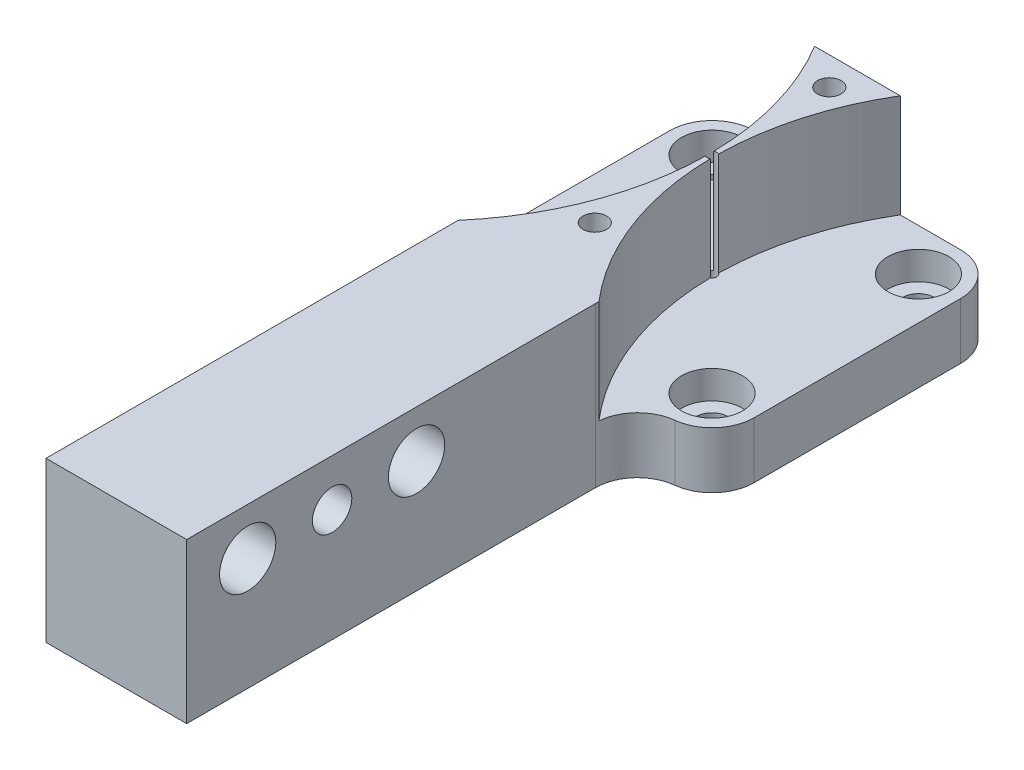
from build123d import *

# Parameters (mm, degrees)
SKETCH1_W                      = 32.5
SKETCH1_H                      = 80.25
BOSS_EXTRUDE1_DEPTH            = 6
BOSS_EXTRUDE2_DEPTH            = 11
F_6_0MM_DOWEL_HOLE1_D          = 6
M5X0_8_TAPPED_HOLE1_D          = 4.2
CBORE_FOR_M3_SHCS1_D           = 3.4
CBORE_FOR_M3_SHCS1_CBORE_D     = 6.5
CBORE_FOR_M3_SHCS1_CBORE_DEPTH = 3
F_1_0_1_DIAMETER_HOLE1_D       = 1
SKETCH12_R                     = 1.5
CUT_EXTRUDE1_DEPTH             = 5
SKETCH13_W                     = 6
SKETCH13_H                     = 35
CUT_EXTRUDE2_DEPTH             = 69.184034055
FILLET1_R                      = 2.38125
SKETCH14_W                     = 34.5
SKETCH14_H                     = 82.25
CUT_EXTRUDE3_DEPTH             = 69.184034055
M3X0_5_START                   = -6
M3X0_5_TAPPED_HOLE1_OUTLINE_R  = 1.25
M3X0_5_TAPPED_HOLE1_DEPTH      = 17


# Read off the part's stored shape, not the designer's step: M3x0.5 Tapped Hole1
with BuildPart() as part:
    # Sketch1 → Boss-Extrude1 (new body)
    with BuildSketch(Plane(origin=(0, 0, 0), x_dir=(1, 0, 0), z_dir=(0, 1, 0))):
        with Locations((0, -23.875)):
            Rectangle(SKETCH1_W, SKETCH1_H)
    extrude(amount=-BOSS_EXTRUDE1_DEPTH)

    # Sketch2 → Boss-Extrude2 (add)
    with BuildSketch(Plane(origin=(0, 0, 0), x_dir=(1, 0, 0), z_dir=(0, 1, 0))):
        with BuildLine():
            Line((-5.032198748, 16.25), (5.032198748, 16.25))
            ThreePointArc((5.032198748, 16.25), (1.230950737, -7.608861929), (16.25, -26.532998323))
            Line((16.25, -26.532998323), (16.25, -64))
            Line((16.25, -64), (-16.25, -64))
            Line((-16.25, -64), (-16.25, -26.532998323))
            ThreePointArc((-16.25, -26.532998323), (-1.230950737, -7.608861929), (-5.032198748, 16.25))
        make_face()
    extrude(amount=BOSS_EXTRUDE2_DEPTH)

    # Ø6.0mm Dowel Hole1 (through all)
    with Locations(Plane(origin=(16.25, 0, 0), x_dir=(0, 0, -1), z_dir=(1, 0, 0))):
        with Locations((-57, 6), (-39, 6)):
            Hole(F_6_0MM_DOWEL_HOLE1_D / 2)

    # M5x0.8 Tapped Hole1 (through all)
    with Locations(Plane(origin=(16.25, 0, 0), x_dir=(0, 0, -1), z_dir=(1, 0, 0))):
        with Locations((-48, 6)):
            Hole(M5X0_8_TAPPED_HOLE1_D / 2)

    # CBORE for M3 SHCS1 (through all)
    with Locations(Plane(origin=(0, 0, 0), x_dir=(1, 0, 0), z_dir=(0, 1, 0))):
        with Locations((-11, 11), (11, 11), (11, -11), (-11, -11)):
            CounterBoreHole(CBORE_FOR_M3_SHCS1_D / 2, CBORE_FOR_M3_SHCS1_CBORE_D / 2, CBORE_FOR_M3_SHCS1_CBORE_DEPTH)

    # Ø1.0 (1) Diameter Hole1 (through all)
    with Locations(Plane(origin=(0, 11, 0), x_dir=(1, 0, 0), z_dir=(0, 1, 0))):
        with Locations((0, 0)):
            Hole(F_1_0_1_DIAMETER_HOLE1_D / 2)

    # Sketch12 → Cut-Extrude1 (cut)
    with BuildSketch(Plane.XZ.offset(6)):
        with Locations(Location((0, 0, 0), (0, 0, 270))):
            Circle(SKETCH12_R)
    extrude(amount=-CUT_EXTRUDE1_DEPTH, mode=Mode.SUBTRACT)

    # Sketch13 → Cut-Extrude2 (cut, through all)
    with BuildSketch(Plane(origin=(0, 11, 0), x_dir=(1, 0, 0), z_dir=(0, 1, 0))):
        with Locations((-13.25, -46.5)):
            Rectangle(SKETCH13_W, SKETCH13_H)
        with Locations((13.25, -46.5)):
            Rectangle(SKETCH13_W, SKETCH13_H)
    extrude(amount=-CUT_EXTRUDE2_DEPTH, mode=Mode.SUBTRACT)

    # Fillet1
    fillet1_edges = [part.edges().sort_by_distance(p)[0] for p in [
        (-10.25, 2.5, 29),
        (10.25, 2.5, 29),
    ]]
    fillet(fillet1_edges, radius=FILLET1_R)

    # Sketch14 → Cut-Extrude3 (cut, through all)
    with BuildSketch(Plane(origin=(0, 11, 0), x_dir=(1, 0, 0), z_dir=(0, 1, 0))):
        with Locations((0, -23.875)):
            Rectangle(SKETCH14_W, SKETCH14_H)
        with BuildLine():
            Line((-7.5, -63.5), (-7.5, -19.94427191))
            ThreePointArc((-7.5, -19.94427191), (-8.645898034, -16.94427191), (-11.5, -15.472135955))
            ThreePointArc((-11.5, -15.472135955), (-14.354101966, -14), (-15.5, -11))
            Line((-15.5, -11), (-15.5, 11))
            ThreePointArc((-15.5, 11), (-14.181980515, 14.181980515), (-11, 15.5))
            Line((-11, 15.5), (11, 15.5))
            ThreePointArc((11, 15.5), (14.181980515, 14.181980515), (15.5, 11))
            Line((15.5, 11), (15.5, -11))
            ThreePointArc((15.5, -11), (14.354101966, -14), (11.5, -15.472135955))
            ThreePointArc((11.5, -15.472135955), (8.645898034, -16.94427191), (7.5, -19.94427191))
            Line((7.5, -19.94427191), (7.5, -63.5))
            Line((7.5, -63.5), (-7.5, -63.5))
        make_face(mode=Mode.SUBTRACT)
    extrude(amount=-CUT_EXTRUDE3_DEPTH, mode=Mode.SUBTRACT)

    # M3x0.5 Tapped Hole1 outline → M3x0.5 Tapped Hole1 (cut)
    with BuildSketch(Plane(origin=(0, 0, 0), x_dir=(1, 0, 0), z_dir=(0, 1, 0)).offset(M3X0_5_START)):
        with Locations((0, -12.5)):
            Circle(M3X0_5_TAPPED_HOLE1_OUTLINE_R)
        with Locations((0, 12.5)):
            Circle(M3X0_5_TAPPED_HOLE1_OUTLINE_R)
    extrude(amount=M3X0_5_TAPPED_HOLE1_DEPTH, mode=Mode.SUBTRACT)


solid = part.part
